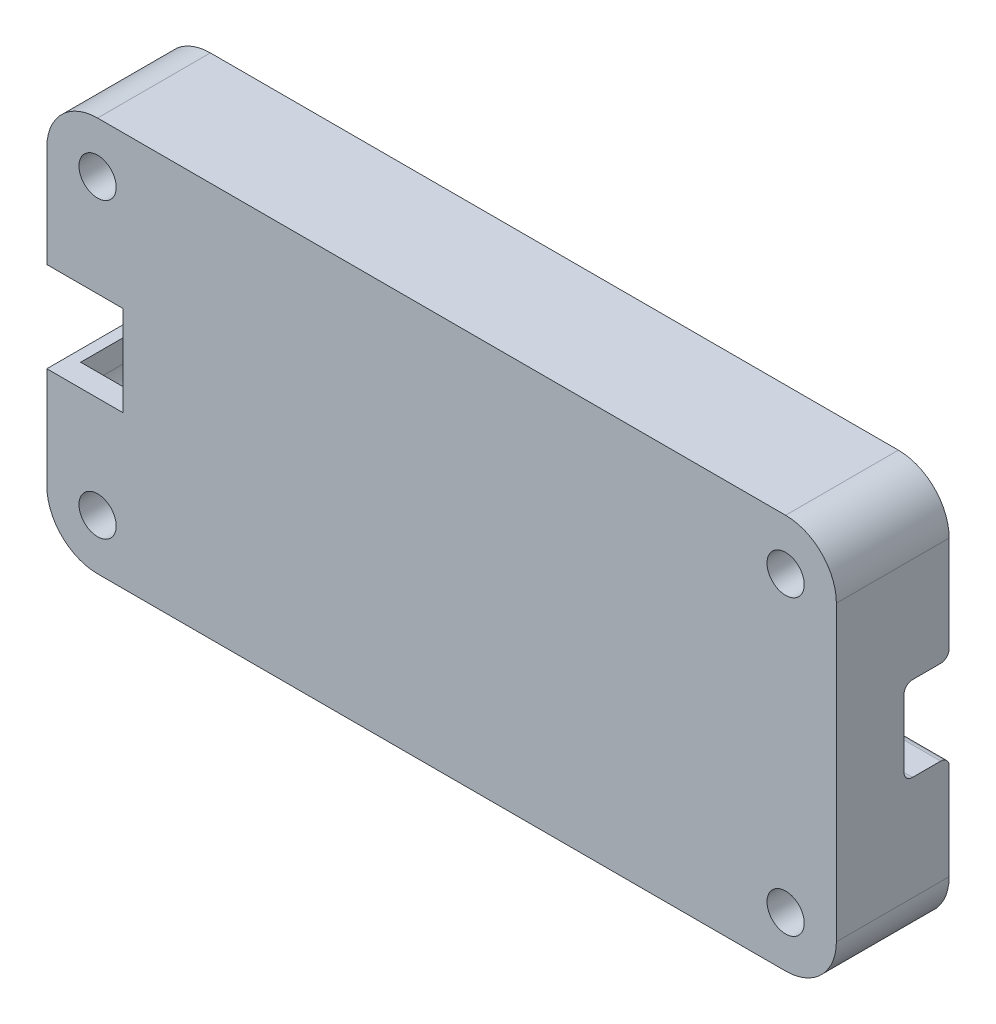
from build123d import *

# Parameters (mm, degrees)
SKETCH1_W           = 70
SKETCH1_H           = 35
BOSS_EXTRUDE1_DEPTH = 10
FILLET1_R           = 4.5
SKETCH2_R           = 1.65
CUT_EXTRUDE1_DEPTH  = 10
SKETCH3_W           = 51
SKETCH3_H           = 30
CUT_EXTRUDE2_DEPTH  = 8
SKETCH4_W           = 6.75
SKETCH4_H           = 8
CUT_EXTRUDE3_DEPTH  = 11
SKETCH5_W           = 8.5
SKETCH5_H           = 16
CUT_EXTRUDE5_DEPTH  = 8
SKETCH6_W           = 9.5
SKETCH6_H           = 7.5
CUT_EXTRUDE6_DEPTH  = 4
FILLET2_R           = 0.75
FILLET3_R           = 5
FILLET4_R           = 7
FILLET5_R           = 5
FILLET6_R           = 2


with BuildPart() as part:
    # Sketch1 → Boss-Extrude1 (new body)
    with BuildSketch(Plane.XY):
        Rectangle(SKETCH1_W, SKETCH1_H)
    extrude(amount=BOSS_EXTRUDE1_DEPTH)

    # Fillet1
    fillet1_edges = [part.edges().sort_by_distance(p)[0] for p in [
        (35, -17.5, 5),
        (-35, -17.5, 5),
        (-35, 17.5, 5),
        (35, 17.5, 5),
    ]]
    fillet(fillet1_edges, radius=FILLET1_R)

    # Sketch2 → Cut-Extrude1 (cut)
    with BuildSketch(Plane.XY.offset(10)):
        with Locations((-30.5, 13)):
            Circle(SKETCH2_R)
        with Locations((30.5, 13)):
            Circle(SKETCH2_R)
        with Locations((30.5, -13)):
            Circle(SKETCH2_R)
        with Locations((-30.5, -13)):
            Circle(SKETCH2_R)
    extrude(amount=-CUT_EXTRUDE1_DEPTH, mode=Mode.SUBTRACT)

    # Sketch3 → Cut-Extrude2 (cut)
    with BuildSketch(Plane(origin=(0, 0, 0), x_dir=(-1, 0, 0), z_dir=(0, 0, -1))):
        Rectangle(SKETCH3_W, SKETCH3_H)
    extrude(amount=-CUT_EXTRUDE2_DEPTH, mode=Mode.SUBTRACT)

    # Sketch4 → Cut-Extrude3 (cut)
    with BuildSketch(Plane(origin=(0, 0, 0), x_dir=(-1, 0, 0), z_dir=(0, 0, -1))):
        with Locations((31.625, 0)):
            Rectangle(SKETCH4_W, SKETCH4_H)
    extrude(amount=-CUT_EXTRUDE3_DEPTH, mode=Mode.SUBTRACT)

    # Sketch5 → Cut-Extrude5 (cut)
    with BuildSketch(Plane(origin=(0, 0, 0), x_dir=(-1, 0, 0), z_dir=(0, 0, -1))):
        with Locations((29.75, 0)):
            Rectangle(SKETCH5_W, SKETCH5_H)
    extrude(amount=-CUT_EXTRUDE5_DEPTH, mode=Mode.SUBTRACT)

    # Sketch6 → Cut-Extrude6 (cut)
    with BuildSketch(Plane(origin=(0, 0, 0), x_dir=(-1, 0, 0), z_dir=(0, 0, -1))):
        with Locations((-30.25, 0)):
            Rectangle(SKETCH6_W, SKETCH6_H)
    extrude(amount=-CUT_EXTRUDE6_DEPTH, mode=Mode.SUBTRACT)

    # Fillet2
    fillet2_edges = [part.edges().sort_by_distance(p)[0] for p in [
        (30.25, 3.75, 4),
        (30.25, -3.75, 4),
        (30.25, -3.75, 0),
        (30.25, 3.75, 0),
    ]]
    fillet(fillet2_edges, radius=FILLET2_R)

    # Fillet3
    fillet3_edges = [part.edges().sort_by_distance(p)[0] for p in [
        (25.5, -15, 4),
        (25.5, 15, 4),
    ]]
    fillet(fillet3_edges, radius=FILLET3_R)

    # Fillet4
    fillet4_edges = [part.edges().sort_by_distance(p)[0] for p in [
        (-25.5, -8, 4),
        (-25.5, 8, 4),
    ]]
    fillet(fillet4_edges, radius=FILLET4_R - 0.0001)  # a hair under: the kernel refuses the full size

    # Fillet5
    fillet5_edges = [part.edges().sort_by_distance(p)[0] for p in [
        (-25.5, 15, 4),
        (-25.5, -15, 4),
    ]]
    fillet(fillet5_edges, radius=FILLET5_R)

    # Fillet6
    fillet6_edges = [part.edges().sort_by_distance(p)[0] for p in [
        (-34, -8, 4),
        (-34, 8, 4),
    ]]
    fillet(fillet6_edges, radius=FILLET6_R)


solid = part.part
